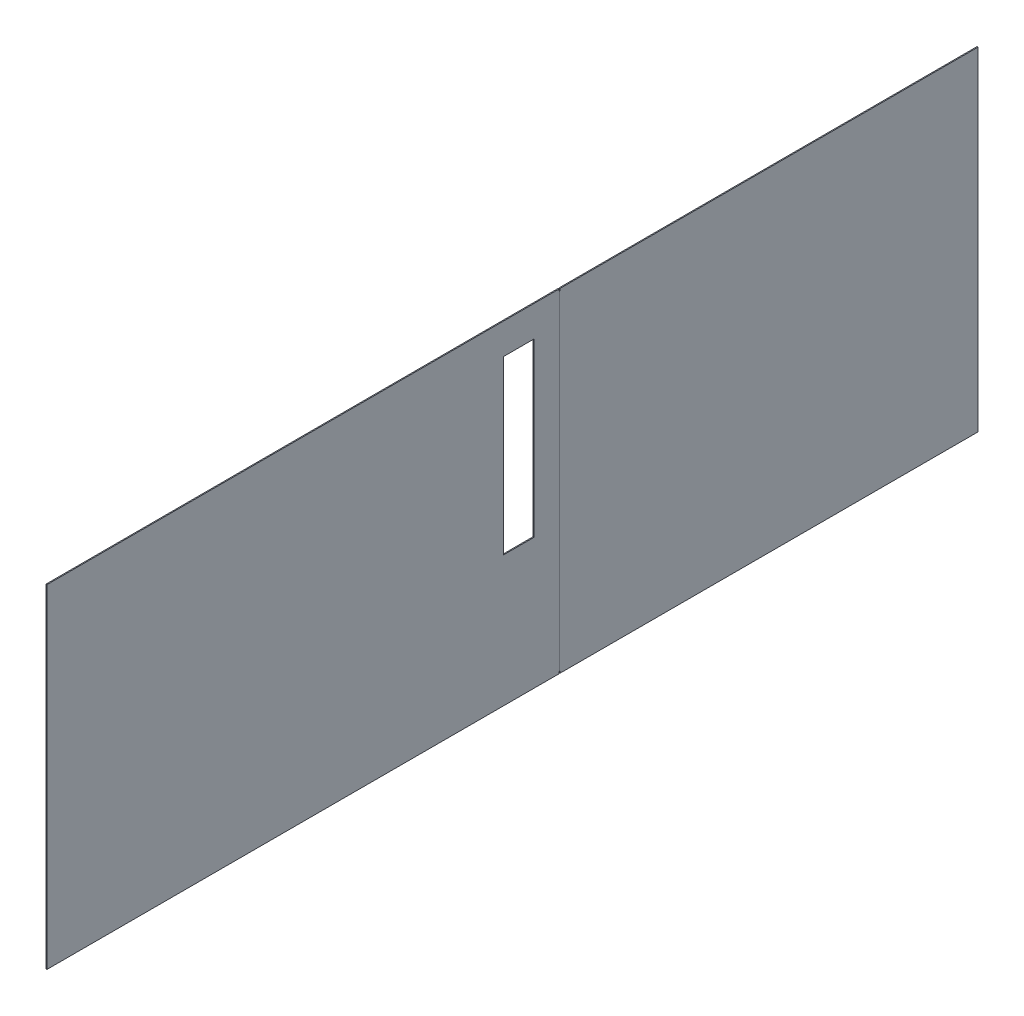
from build123d import *

# Parameters (mm, degrees)
BRIDA_BASE2_DEPTH          = 650
CORTAR_EXTRUIR1_DEPTH      = 1198.029946406
CORTAR_EXTRUIR1_DEPTH_BACK = 1198.029946406
CROQUIS11_W                = 60
CROQUIS11_H                = 335
DESDOBLAR2_DEPTH           = 650
DESDOBLAR2_2_DEPTH         = 650
CORTAR_EXTRUIR2_DEPTH      = 1193.687557577
CORTAR_EXTRUIR2_DEPTH_BACK = 1193.687557577


# Read off the part's stored shape, not the designer's step: Desdoblar2
# Sheet-metal steps are written as plain solids
with BuildPart() as part:
    # Croquis1 → Brida base2 (new body)
    with BuildSketch(Plane(origin=(0, 0, 0), x_dir=(1, 0, 0), z_dir=(0, 1, 0))):
        with BuildLine():
            Line((0, -1000), (0, -0.162137614))
            ThreePointArc((0, -0.162137614), (0.004971228, -0.000305705), (0.019866166, 0.160915945))
            Line((0.019866166, 0.160915945), (100, 810))
            Line((100, 810), (101.885683943, 809.767199513))
            Line((101.885683943, 809.767199513), (1.905550109, -0.071884541))
            ThreePointArc((1.905550109, -0.071884541), (1.901388837, -0.116925833), (1.9, -0.162137614))
            Line((1.9, -0.162137614), (1.9, -1000))
            Line((1.9, -1000), (0, -1000))
        make_face()
    extrude(amount=BRIDA_BASE2_DEPTH)

    # Croquis11 → Cortar-Extruir1 (cut, two sides: drawn at the far end of the back side and taken through both)
    with BuildSketch(Plane.ZY.offset(-CORTAR_EXTRUIR1_DEPTH_BACK)):
        with Locations((80, 422.5)):
            Rectangle(CROQUIS11_W, CROQUIS11_H)
    extrude(amount=CORTAR_EXTRUIR1_DEPTH + CORTAR_EXTRUIR1_DEPTH_BACK, mode=Mode.SUBTRACT)

    # Desdoblar2 outline → Desdoblar2 (cut)
    with BuildSketch(Plane(origin=(0, 0, 0), x_dir=(1, 0, 0), z_dir=(0, 1, 0))):
        with BuildLine():
            Line((100, 810), (1.9, 15.39))
            Line((1.9, 15.39), (1.9, -0.162137614))
            ThreePointArc((1.9, -0.162137614), (1.901388837, -0.116925832), (1.905550109, -0.071884541))
            Line((1.905550109, -0.071884541), (101.885683943, 809.767199513))
            Line((101.885683943, 809.767199513), (100, 810))
        make_face()
    extrude(amount=DESDOBLAR2_DEPTH, mode=Mode.SUBTRACT)

    # Desdoblar2 2 outline → Desdoblar2 2 (add)
    with BuildSketch(Plane(origin=(0, 0, 0), x_dir=(1, 0, 0), z_dir=(0, 1, 0))):
        with BuildLine():
            Line((1.9, 15.39), (1.9, 816.032394795))
            Line((1.9, 816.032394795), (0, 816.032394795))
            Line((0, 816.032394795), (0, -0.162137614))
            ThreePointArc((0, -0.162137614), (0.004971228, -0.000305705), (0.019866166, 0.160915945))
            Line((0.019866166, 0.160915945), (1.9, 15.39))
        make_face()
    extrude(amount=DESDOBLAR2_2_DEPTH)

    # Croquis12 → Cortar-Extruir2 (cut, two sides: drawn at the far end of the back side and taken through both)
    with BuildSketch(Plane.ZY.offset(-CORTAR_EXTRUIR2_DEPTH_BACK)):
        with BuildLine():
            ThreePointArc((0.108550657, 646), (0.135363814, 646.000513721), (0.162137614, 646.00205413))
            Line((0.162137614, 646.00205413), (0.162137614, 650))
            Line((0.162137614, 650), (-0.691449343, 650))
            Line((-0.691449343, 650), (-0.691449343, 646.7))
            ThreePointArc((-0.691449343, 646.7), (-0.486424089, 646.205025253), (0.008550657, 646))
            Line((0.008550657, 646), (0.108550657, 646))
        make_face()
        with BuildLine():
            Line((0.162137614, 650), (0.162137614, 646.00205413))
            ThreePointArc((0.162137614, 646.00205413), (0.622121913, 646.224348273), (0.808550657, 646.7))
            Line((0.808550657, 646.7), (0.808550657, 650))
            Line((0.808550657, 650), (0.162137614, 650))
        make_face()
        with BuildLine():
            Line((-0.691449343, 0), (-0.045036299, 0))
            Line((-0.045036299, 0), (0.162137614, 0))
            Line((0.162137614, 0), (0.162137614, 3.99794587))
            ThreePointArc((0.162137614, 3.99794587), (0.135363814, 3.999486279), (0.108550657, 4))
            Line((0.108550657, 4), (0.008550657, 4))
            ThreePointArc((0.008550657, 4), (-0.486424089, 3.794974747), (-0.691449343, 3.3))
            Line((-0.691449343, 3.3), (-0.691449343, 0))
        make_face()
        with BuildLine():
            Line((0.162137614, 3.99794587), (0.162137614, 0))
            Line((0.162137614, 0), (0.808550657, 0))
            Line((0.808550657, 0), (0.808550657, 3.3))
            ThreePointArc((0.808550657, 3.3), (0.622121913, 3.775651727), (0.162137614, 3.99794587))
        make_face()
    extrude(amount=CORTAR_EXTRUIR2_DEPTH + CORTAR_EXTRUIR2_DEPTH_BACK, mode=Mode.SUBTRACT)


solid = part.part
